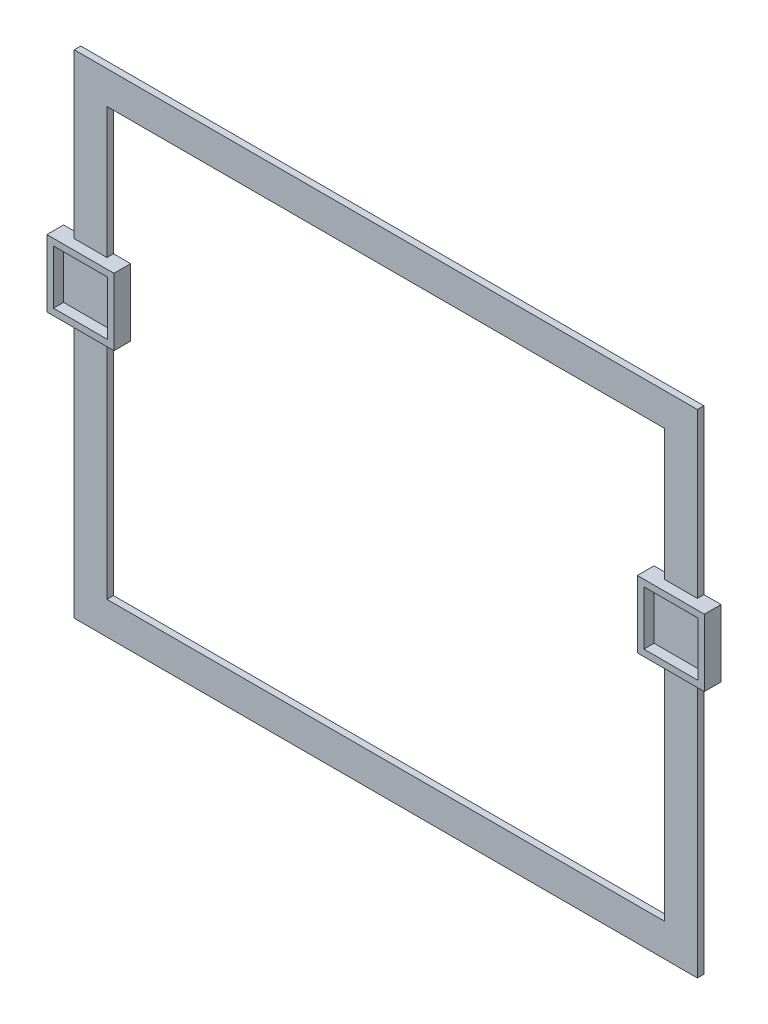
from build123d import *

# Parameters (mm, degrees)
SKETCH1_W             = 52.07
SKETCH1_H             = 52.07
SKETCH1_W_2           = 41.91
SKETCH1_H_2           = 41.91
BOSS_EXTRUDE1_DEPTH   = 7.874
BOSS_EXTRUDE1_2_DEPTH = 7.874
BOSS_EXTRUDE3_DEPTH   = 5.08
BOSS_EXTRUDE3_2_DEPTH = 5.08
SKETCH3_W             = 52.07
SKETCH3_H             = 52.07
BOSS_EXTRUDE4_DEPTH   = 5.08


with BuildPart() as part:
    # Sketch1 → Boss-Extrude1 (new body)
    with BuildSketch(Plane.XY):
        with Locations((20.955, 20.955)):
            Rectangle(SKETCH1_W, SKETCH1_H)
        with Locations((20.955, 20.955)):
            Rectangle(SKETCH1_W_2, SKETCH1_H_2, mode=Mode.SUBTRACT)
    extrude(amount=BOSS_EXTRUDE1_DEPTH)



with BuildPart() as body_2:
    # Sketch1 → Boss-Extrude1 2 (new body)
    with BuildSketch(Plane.XY):
        with Locations((479.425, 20.955)):
            Rectangle(SKETCH1_W, SKETCH1_H)
        with Locations((479.425, 20.955)):
            Rectangle(SKETCH1_W_2, SKETCH1_H_2, mode=Mode.SUBTRACT)
    extrude(amount=BOSS_EXTRUDE1_2_DEPTH)


with BuildPart() as body_3:
    # Sketch2 → Boss-Extrude3 (new body)
    with BuildSketch(Plane(origin=(0, 0, 0), x_dir=(-1, 0, 0), z_dir=(0, 0, -1))):
        Polygon((-8.255, -208.28), (-8.255, -5.08), (-33.655, -5.08), (-33.655, -182.88), (-466.725, -182.88), (-466.725, -5.08), (-492.125, -5.08), (-492.125, -208.28), align=None)
    extrude(amount=BOSS_EXTRUDE3_DEPTH)


with BuildPart() as body_4:
    # Sketch2 → Boss-Extrude3 2 (new body)
    with BuildSketch(Plane(origin=(0, 0, 0), x_dir=(-1, 0, 0), z_dir=(0, 0, -1))):
        Polygon((-33.655, 46.99), (-8.255, 46.99), (-8.255, 173.99), (-492.125, 173.99), (-492.125, 46.99), (-466.725, 46.99), (-466.725, 148.59), (-33.655, 148.59), align=None)
    extrude(amount=BOSS_EXTRUDE3_2_DEPTH)


with BuildPart() as part_1:
    add(part.part)

    add(body_2.part)  # Boss-Extrude4 merges body 2

    add(body_3.part)  # Boss-Extrude4 merges body 3

    add(body_4.part)  # Boss-Extrude4 merges body 4
    # Sketch3 → Boss-Extrude4 (add)
    with BuildSketch(Plane(origin=(0, 0, 0), x_dir=(-1, 0, 0), z_dir=(0, 0, -1))):
        with Locations((-20.955, 20.955)):
            Rectangle(SKETCH3_W, SKETCH3_H)
        with Locations((-479.425, 20.955)):
            Rectangle(SKETCH3_W, SKETCH3_H)
    extrude(amount=BOSS_EXTRUDE4_DEPTH)


solid = part_1.part
